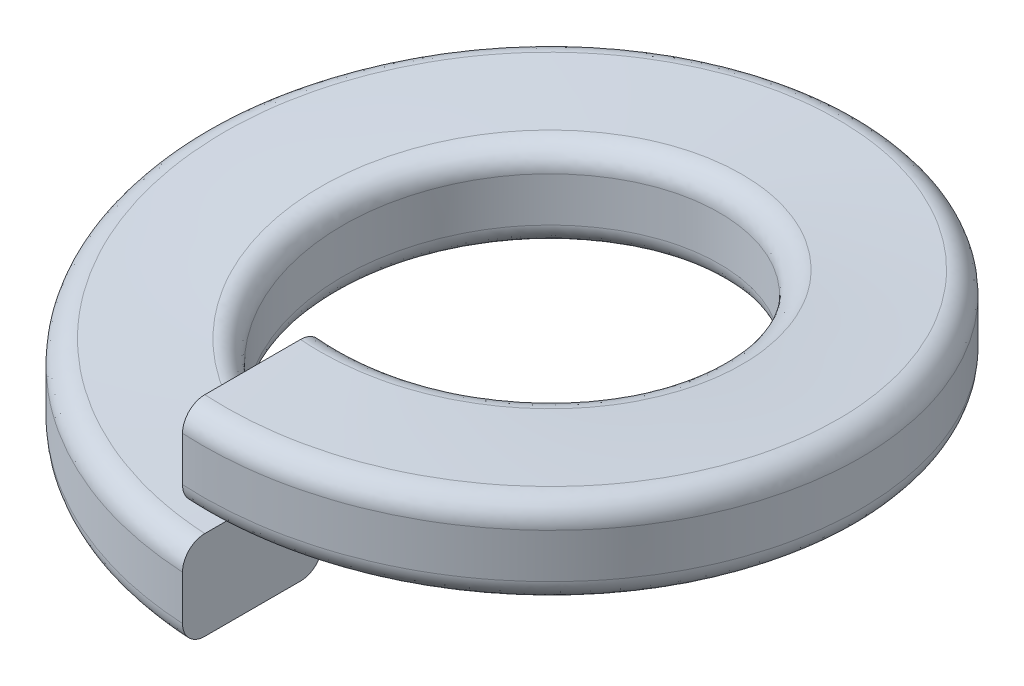
from build123d import *

# Parameters (mm, degrees)
SWEEP1_PITCH  = 2.7
SWEEP1_HEIGHT = 2.7
SWEEP1_RADIUS = 4.25
SKETCH2_W     = 3.15
SKETCH2_H     = 2
FILLET1_R     = 0.5


with BuildPart() as part:
    # Sweep1: sweep along a helix
    with BuildLine() as sweep1_path:
        Helix(SWEEP1_PITCH, SWEEP1_HEIGHT, SWEEP1_RADIUS, center=(0, 0, 0), direction=(0, 1, 0), lefthand=True)
    # Sketch2 → Sweep1 (sweep)
    with BuildSketch(Plane(origin=(0, 0, 0), x_dir=(0, 0, -1), z_dir=(1, 0, 0))):
        with Locations((-5.825, 1)):
            Rectangle(SKETCH2_W, SKETCH2_H)
    sweep(path=sweep1_path.line, is_frenet=True)

    # Fillet1
    fillet1_edges = [part.edges().sort_by_distance(p)[0] for p in [
        (0, 1.35, -7.399992033),
        (0, 1.35, -4.249995425),
        (0, 3.35, -4.249995425),
        (0, 3.35, -7.399992034),
    ]]
    fillet(fillet1_edges, radius=FILLET1_R)


solid = part.part
